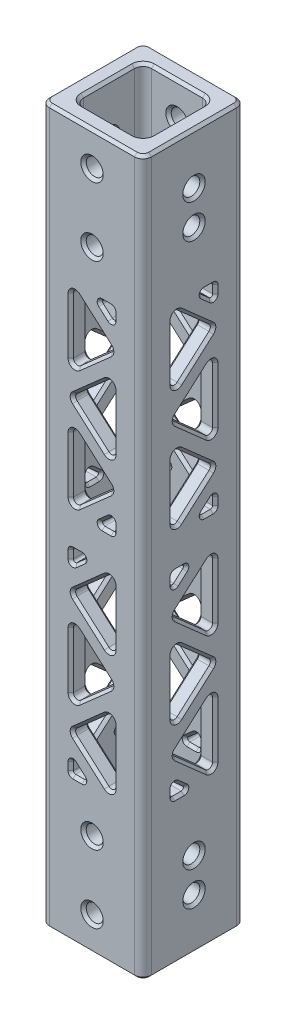
from build123d import *

# Parameters (mm, degrees)
SKETCH1_W                    = 19.05
SKETCH1_H                    = 19.05
SKETCH1_W_2                  = 12.7
SKETCH1_H_2                  = 12.7
BOSS_EXTRUDE1_DEPTH          = 66.675
F_1_8_0_125_DIAMETER_HOLE1_D = 3.175
F_1_8_0_125_DIAMETER_HOLE2_D = 3.175
F_1_8_0_125_DIAMETER_HOLE3_D = 3.175
CUT_EXTRUDE1_REACH           = 70.022
CIRPATTERN2_COUNT            = 4
FILLET1_R                    = 1.5875
FILLET2_R                    = 0.79375
FILLET3_R                    = 0.396875
CHAMFER2_SIZE                = 0.508


with BuildPart() as part:
    # Sketch1 → Boss-Extrude1 (new, symmetric)
    with BuildSketch(Plane(origin=(0, 0, 0), x_dir=(1, 0, 0), z_dir=(0, 1, 0))):
        Rectangle(SKETCH1_W, SKETCH1_H)
        Rectangle(SKETCH1_W_2, SKETCH1_H_2, mode=Mode.SUBTRACT)
    extrude(amount=BOSS_EXTRUDE1_DEPTH, both=True)

    # 1/8 (0.125) Diameter Hole1 (through all)
    with Locations(Plane.ZY.offset(9.525)):
        with Locations((0, 57.15), (0, 50.8)):
            Hole(F_1_8_0_125_DIAMETER_HOLE1_D / 2)

    # 1/8 (0.125) Diameter Hole2 (through all)
    with Locations(Plane(origin=(9.525, 0, 0), x_dir=(0, 0, -1), z_dir=(1, 0, 0))):
        with Locations((0, -50.8), (0, -57.15)):
            Hole(F_1_8_0_125_DIAMETER_HOLE2_D / 2)

    # 1/8 (0.125) Diameter Hole3 (through all)
    with Locations(Plane.XY.offset(9.525)):
        with Locations((0, 60.325), (0, 47.625), (0, -47.625), (0, -60.325)):
            Hole(F_1_8_0_125_DIAMETER_HOLE3_D / 2)

    # Sketch15 → Cut-Extrude1 (cut, up to next)
    with BuildSketch(Plane.XY, mode=Mode.PRIVATE) as cut_extrude1_sk1:
        Polygon((-3.96875, 39.6875), (-0.827576232, 39.6875), (-3.96875, 36.91331643), align=None)
    cut_extrude1_tool1 = extrude(cut_extrude1_sk1.sketch, amount=-CUT_EXTRUDE1_REACH, mode=Mode.PRIVATE) & part.part
    # Sketch15 → Cut-Extrude1 (cut, up to next)
    with BuildSketch(Plane.XY, mode=Mode.PRIVATE) as cut_extrude1_sk2:
        Polygon((-3.96875, 32.677355477), (3.96875, 39.6875), (3.96875, 25.667210953), align=None)
    cut_extrude1_tool2 = extrude(cut_extrude1_sk2.sketch, amount=-CUT_EXTRUDE1_REACH, mode=Mode.PRIVATE) & part.part
    # Sketch15 → Cut-Extrude1 (cut, up to next)
    with BuildSketch(Plane.XY, mode=Mode.PRIVATE) as cut_extrude1_sk3:
        Polygon((-3.96875, 28.441394523), (3.96875, 21.43125), (-3.96875, 14.421105477), align=None)
    cut_extrude1_tool3 = extrude(cut_extrude1_sk3.sketch, amount=-CUT_EXTRUDE1_REACH, mode=Mode.PRIVATE) & part.part
    # Sketch15 → Cut-Extrude1 (cut, up to next)
    with BuildSketch(Plane.XY, mode=Mode.PRIVATE) as cut_extrude1_sk4:
        Polygon((-3.96875, 10.185144523), (3.96875, 17.195289047), (3.96875, 3.175), align=None)
    cut_extrude1_tool4 = extrude(cut_extrude1_sk4.sketch, amount=-CUT_EXTRUDE1_REACH, mode=Mode.PRIVATE) & part.part
    # Sketch15 → Cut-Extrude1 (cut, up to next)
    with BuildSketch(Plane.XY, mode=Mode.PRIVATE) as cut_extrude1_sk5:
        Polygon((-3.96875, 3.175), (-0.827576232, 3.175), (-3.96875, 5.94918357), align=None)
    cut_extrude1_tool5 = extrude(cut_extrude1_sk5.sketch, amount=-CUT_EXTRUDE1_REACH, mode=Mode.PRIVATE) & part.part
    # Sketch15 → Cut-Extrude1 (cut, up to next)
    with BuildSketch(Plane.XY, mode=Mode.PRIVATE) as cut_extrude1_sk6:
        Polygon((0.827576232, -3.175), (3.96875, -3.175), (3.96875, -5.94918357), align=None)
    cut_extrude1_tool6 = extrude(cut_extrude1_sk6.sketch, amount=-CUT_EXTRUDE1_REACH, mode=Mode.PRIVATE) & part.part
    # Sketch15 → Cut-Extrude1 (cut, up to next)
    with BuildSketch(Plane.XY, mode=Mode.PRIVATE) as cut_extrude1_sk7:
        Polygon((-3.96875, -3.175), (3.96875, -10.185144523), (-3.96875, -17.195289047), align=None)
    cut_extrude1_tool7 = extrude(cut_extrude1_sk7.sketch, amount=-CUT_EXTRUDE1_REACH, mode=Mode.PRIVATE) & part.part
    # Sketch15 → Cut-Extrude1 (cut, up to next)
    with BuildSketch(Plane.XY, mode=Mode.PRIVATE) as cut_extrude1_sk8:
        Polygon((-3.96875, -21.43125), (3.96875, -14.421105477), (3.96875, -28.441394523), align=None)
    cut_extrude1_tool8 = extrude(cut_extrude1_sk8.sketch, amount=-CUT_EXTRUDE1_REACH, mode=Mode.PRIVATE) & part.part
    # Sketch15 → Cut-Extrude1 (cut, up to next)
    with BuildSketch(Plane.XY, mode=Mode.PRIVATE) as cut_extrude1_sk9:
        Polygon((-3.96875, -39.6875), (3.96875, -32.677355477), (-3.96875, -25.667210953), align=None)
    cut_extrude1_tool9 = extrude(cut_extrude1_sk9.sketch, amount=-CUT_EXTRUDE1_REACH, mode=Mode.PRIVATE) & part.part
    # Sketch15 → Cut-Extrude1 (cut, up to next)
    with BuildSketch(Plane.XY, mode=Mode.PRIVATE) as cut_extrude1_sk10:
        Polygon((0.827576232, -39.6875), (3.96875, -39.6875), (3.96875, -36.91331643), align=None)
    cut_extrude1_tool10 = extrude(cut_extrude1_sk10.sketch, amount=-CUT_EXTRUDE1_REACH, mode=Mode.PRIVATE) & part.part
    cut_extrude1_1 = cut_extrude1_tool1.solids().sort_by_distance((-2.921692, 38.762772, 0))[0]
    add(cut_extrude1_1, mode=Mode.SUBTRACT)
    cut_extrude1_2 = cut_extrude1_tool2.solids().sort_by_distance((1.322917, 32.677355, 0))[0]
    add(cut_extrude1_2, mode=Mode.SUBTRACT)
    cut_extrude1_3 = cut_extrude1_tool3.solids().sort_by_distance((-1.322917, 21.43125, 0))[0]
    add(cut_extrude1_3, mode=Mode.SUBTRACT)
    cut_extrude1_4 = cut_extrude1_tool4.solids().sort_by_distance((1.322917, 10.185145, 0))[0]
    add(cut_extrude1_4, mode=Mode.SUBTRACT)
    cut_extrude1_5 = cut_extrude1_tool5.solids().sort_by_distance((-2.921692, 4.099728, 0))[0]
    add(cut_extrude1_5, mode=Mode.SUBTRACT)
    cut_extrude1_6 = cut_extrude1_tool6.solids().sort_by_distance((2.921692, -4.099728, 0))[0]
    add(cut_extrude1_6, mode=Mode.SUBTRACT)
    cut_extrude1_7 = cut_extrude1_tool7.solids().sort_by_distance((-1.322917, -10.185145, 0))[0]
    add(cut_extrude1_7, mode=Mode.SUBTRACT)
    cut_extrude1_8 = cut_extrude1_tool8.solids().sort_by_distance((1.322917, -21.43125, 0))[0]
    add(cut_extrude1_8, mode=Mode.SUBTRACT)
    cut_extrude1_9 = cut_extrude1_tool9.solids().sort_by_distance((-1.322917, -32.677355, 0))[0]
    add(cut_extrude1_9, mode=Mode.SUBTRACT)
    cut_extrude1_10 = cut_extrude1_tool10.solids().sort_by_distance((2.921692, -38.762772, 0))[0]
    add(cut_extrude1_10, mode=Mode.SUBTRACT)
    cut_extrude1 = cut_extrude1_1 + cut_extrude1_2 + cut_extrude1_3 + cut_extrude1_4 + cut_extrude1_5 + cut_extrude1_6 + cut_extrude1_7 + cut_extrude1_8 + cut_extrude1_9 + cut_extrude1_10  # Cut-Extrude1 as one shape, for the pattern or mirror that repeats it

    # CirPattern2: Cut-Extrude1 ×4 about axis
    cirpattern2_axis = Axis((0, 0, 0), (0, 1, 0))
    for i in range(1, CIRPATTERN2_COUNT):
        add(cut_extrude1.rotate(cirpattern2_axis, i * 360 / CIRPATTERN2_COUNT), mode=Mode.SUBTRACT)

    # Fillet1
    fillet1_edges = [part.edges().sort_by_distance(p)[0] for p in [
        (6.35, 0, 6.35),
        (6.35, 0, -6.35),
        (-6.35, 0, -6.35),
        (-6.35, 0, 6.35),
        (9.525, 0, 9.525),
        (-9.525, 0, 9.525),
        (-9.525, 0, -9.525),
        (9.525, 0, -9.525),
    ]]
    fillet(fillet1_edges, radius=FILLET1_R)

    # Fillet2
    fillet2_edges = [part.edges().sort_by_distance(p)[0] for p in [
        (-3.96875, 14.421105477, -7.9375),
        (-3.96875, 28.441394523, -7.9375),
        (3.96875, 21.43125, -7.9375),
        (3.96875, 3.175, -7.9375),
        (-3.96875, 10.185144523, -7.9375),
        (3.96875, 17.195289047, -7.9375),
        (-3.96875, -17.195289047, -7.9375),
        (-3.96875, -3.175, -7.9375),
        (3.96875, -10.185144523, -7.9375),
        (3.96875, 39.6875, -7.9375),
        (3.96875, 25.667210953, -7.9375),
        (-3.96875, 32.677355477, -7.9375),
        (-3.96875, -39.6875, -7.9375),
        (-3.96875, -25.667210953, -7.9375),
        (3.96875, -32.677355477, -7.9375),
        (3.96875, -28.441394523, -7.9375),
        (-3.96875, -21.43125, -7.9375),
        (3.96875, -14.421105477, -7.9375),
        (-3.96875, 39.6875, 7.9375),
        (-3.96875, 25.667210953, 7.9375),
        (3.96875, 32.677355477, 7.9375),
        (-7.9375, -28.441394523, -3.96875),
        (-7.9375, -21.43125, 3.96875),
        (-7.9375, -14.421105477, -3.96875),
        (3.96875, 14.421105477, 7.9375),
        (3.96875, 28.441394523, 7.9375),
        (-3.96875, 21.43125, 7.9375),
        (3.96875, -39.6875, 7.9375),
        (3.96875, -25.667210953, 7.9375),
        (-3.96875, -32.677355477, 7.9375),
        (-7.9375, -39.6875, 3.96875),
        (-7.9375, -25.667210953, 3.96875),
        (-7.9375, -32.677355477, -3.96875),
        (-7.9375, 39.6875, -3.96875),
        (-7.9375, 25.667210953, -3.96875),
        (-7.9375, 32.677355477, 3.96875),
        (-7.9375, -17.195289047, 3.96875),
        (-7.9375, -3.175, 3.96875),
        (-7.9375, -10.185144523, -3.96875),
        (-7.9375, 3.175, -3.96875),
        (-7.9375, 10.185144523, 3.96875),
        (-7.9375, 17.195289047, -3.96875),
        (-7.9375, 14.421105477, 3.96875),
        (-7.9375, 28.441394523, 3.96875),
        (-7.9375, 21.43125, -3.96875),
        (7.9375, -17.195289047, -3.96875),
        (7.9375, -3.175, -3.96875),
        (7.9375, -10.185144523, 3.96875),
        (7.9375, 3.175, 3.96875),
        (7.9375, 10.185144523, -3.96875),
        (7.9375, 17.195289047, 3.96875),
        (7.9375, 14.421105477, -3.96875),
        (7.9375, 28.441394523, -3.96875),
        (7.9375, 21.43125, 3.96875),
        (7.9375, -28.441394523, 3.96875),
        (7.9375, -21.43125, -3.96875),
        (7.9375, -14.421105477, 3.96875),
        (-3.96875, -28.441394523, 7.9375),
        (3.96875, -21.43125, 7.9375),
        (-3.96875, -14.421105477, 7.9375),
        (3.96875, -17.195289047, 7.9375),
        (3.96875, -3.175, 7.9375),
        (-3.96875, -10.185144523, 7.9375),
        (-3.96875, 3.175, 7.9375),
        (3.96875, 10.185144523, 7.9375),
        (-3.96875, 17.195289047, 7.9375),
        (7.9375, -39.6875, -3.96875),
        (7.9375, -25.667210953, -3.96875),
        (7.9375, -32.677355477, 3.96875),
        (7.9375, 39.6875, 3.96875),
        (7.9375, 25.667210953, 3.96875),
        (7.9375, 32.677355477, -3.96875),
    ]]
    fillet(fillet2_edges, radius=FILLET2_R)

    # Fillet3
    fillet3_edges = [part.edges().sort_by_distance(p)[0] for p in [
        (3.96875, -5.94918357, -7.9375),
        (0.827576232, -3.175, -7.9375),
        (3.96875, -3.175, -7.9375),
        (3.96875, -36.91331643, -7.9375),
        (3.96875, -39.6875, -7.9375),
        (0.827576232, -39.6875, -7.9375),
        (-3.96875, 3.175, -7.9375),
        (-3.96875, 5.94918357, -7.9375),
        (-0.827576232, 3.175, -7.9375),
        (-3.96875, 36.91331643, -7.9375),
        (-3.96875, 39.6875, -7.9375),
        (-0.827576232, 39.6875, -7.9375),
        (-3.96875, -36.91331643, 7.9375),
        (-3.96875, -39.6875, 7.9375),
        (-0.827576232, -39.6875, 7.9375),
        (3.96875, 36.91331643, 7.9375),
        (3.96875, 39.6875, 7.9375),
        (0.827576232, 39.6875, 7.9375),
        (-3.96875, -5.94918357, 7.9375),
        (-0.827576232, -3.175, 7.9375),
        (-3.96875, -3.175, 7.9375),
        (3.96875, 3.175, 7.9375),
        (3.96875, 5.94918357, 7.9375),
        (0.827576232, 3.175, 7.9375),
        (-7.9375, 3.175, 3.96875),
        (-7.9375, 5.94918357, 3.96875),
        (-7.9375, 3.175, 0.827576232),
        (-7.9375, -36.91331643, -3.96875),
        (-7.9375, -39.6875, -3.96875),
        (-7.9375, -39.6875, -0.827576232),
        (-7.9375, -5.94918357, -3.96875),
        (-7.9375, -3.175, -0.827576232),
        (-7.9375, -3.175, -3.96875),
        (7.9375, -5.94918357, 3.96875),
        (7.9375, -3.175, 0.827576232),
        (7.9375, -3.175, 3.96875),
        (7.9375, 36.91331643, -3.96875),
        (7.9375, 39.6875, -3.96875),
        (7.9375, 39.6875, -0.827576232),
        (7.9375, 3.175, -3.96875),
        (7.9375, 5.94918357, -3.96875),
        (7.9375, 3.175, -0.827576232),
        (7.9375, -36.91331643, 3.96875),
        (7.9375, -39.6875, 3.96875),
        (7.9375, -39.6875, 0.827576232),
        (-7.9375, 36.91331643, 3.96875),
        (-7.9375, 39.6875, 3.96875),
        (-7.9375, 39.6875, 0.827576232),
    ]]
    fillet(fillet3_edges, radius=FILLET3_R)

    # Chamfer2
    chamfer2_edges = [part.edges().sort_by_distance(p)[0] for p in [
        (9.525, 3.175, -2.724184334),
        (6.35, 3.175, -2.724184334),
        (9.525, 4.320528112, -3.96875),
        (6.35, 4.320528112, -3.96875),
        (9.525, 4.617999722, -2.461466982),
        (6.35, 4.617999722, -2.461466982),
        (3.96875, -4.320528112, -9.525),
        (3.96875, -4.320528112, -6.35),
        (2.461466982, -4.617999722, -9.525),
        (2.461466982, -4.617999722, -6.35),
        (2.724184334, -3.175, -9.525),
        (2.724184334, -3.175, -6.35),
        (-2.724184334, 3.175, -9.525),
        (-2.724184334, 3.175, -6.35),
        (-3.96875, 4.320528112, -9.525),
        (-3.96875, 4.320528112, -6.35),
        (-2.461466982, 4.617999722, -9.525),
        (-2.461466982, 4.617999722, -6.35),
        (-9.525, 4.617999722, 2.461466982),
        (-6.35, 4.617999722, 2.461466982),
        (-9.525, 3.175, 2.724184334),
        (-6.35, 3.175, 2.724184334),
        (-9.525, 4.320528112, 3.96875),
        (-6.35, 4.320528112, 3.96875),
        (-9.525, -4.320528112, -3.96875),
        (-6.35, -4.320528112, -3.96875),
        (-9.525, -4.617999722, -2.461466982),
        (-6.35, -4.617999722, -2.461466982),
        (-9.525, -3.175, -2.724184334),
        (-6.35, -3.175, -2.724184334),
        (-2.724184334, -3.175, 9.525),
        (-2.724184334, -3.175, 6.35),
        (-3.96875, -4.320528112, 9.525),
        (-3.96875, -4.320528112, 6.35),
        (-2.461466982, -4.617999722, 9.525),
        (-2.461466982, -4.617999722, 6.35),
        (2.461466982, 4.617999722, 9.525),
        (2.461466982, 4.617999722, 6.35),
        (2.724184334, 3.175, 9.525),
        (2.724184334, 3.175, 6.35),
        (3.96875, 4.320528112, 9.525),
        (3.96875, 4.320528112, 6.35),
        (2.724184334, -39.6875, -9.525),
        (2.724184334, -39.6875, -6.35),
        (2.461466982, -38.244500278, -9.525),
        (2.461466982, -38.244500278, -6.35),
        (3.96875, -38.541971888, -9.525),
        (3.96875, -38.541971888, -6.35),
        (-2.461466982, 38.244500278, -9.525),
        (-2.461466982, 38.244500278, -6.35),
        (-3.96875, 38.541971888, -9.525),
        (-3.96875, 38.541971888, -6.35),
        (-2.724184334, 39.6875, -9.525),
        (-2.724184334, 39.6875, -6.35),
        (9.525, -39.6875, 2.724184334),
        (6.35, -39.6875, 2.724184334),
        (9.525, -38.244500278, 2.461466982),
        (6.35, -38.244500278, 2.461466982),
        (9.525, -38.541971888, 3.96875),
        (6.35, -38.541971888, 3.96875),
        (9.525, 38.244500278, -2.461466982),
        (6.35, 38.244500278, -2.461466982),
        (9.525, 38.541971888, -3.96875),
        (6.35, 38.541971888, -3.96875),
        (9.525, 39.6875, -2.724184334),
        (6.35, 39.6875, -2.724184334),
        (-2.724184334, -39.6875, 9.525),
        (-2.724184334, -39.6875, 6.35),
        (-2.461466982, -38.244500278, 9.525),
        (-2.461466982, -38.244500278, 6.35),
        (-3.96875, -38.541971888, 9.525),
        (-3.96875, -38.541971888, 6.35),
        (2.461466982, 38.244500278, 9.525),
        (2.461466982, 38.244500278, 6.35),
        (3.96875, 38.541971888, 9.525),
        (3.96875, 38.541971888, 6.35),
        (2.724184334, 39.6875, 9.525),
        (2.724184334, 39.6875, 6.35),
        (-9.525, -39.6875, -2.724184334),
        (-6.35, -39.6875, -2.724184334),
        (-9.525, -38.244500278, -2.461466982),
        (-6.35, -38.244500278, -2.461466982),
        (-9.525, -38.541971888, -3.96875),
        (-6.35, -38.541971888, -3.96875),
        (-9.525, 38.244500278, 2.461466982),
        (-6.35, 38.244500278, 2.461466982),
        (-9.525, 38.541971888, 3.96875),
        (-6.35, 38.541971888, 3.96875),
        (-9.525, 39.6875, 2.724184334),
        (-6.35, 39.6875, 2.724184334),
        (6.35, -3.291241996, 3.852508004),
        (9.525, -3.291241996, 3.852508004),
        (6.35, -3.431427999, 1.50530045),
        (9.525, -3.431427999, 1.50530045),
        (6.35, -5.430965494, 3.735037215),
        (9.525, -5.430965494, 3.735037215),
        (6.35, 3.291241996, -3.852508004),
        (9.525, 3.291241996, -3.852508004),
        (6.35, 5.430965494, -3.735037215),
        (9.525, 5.430965494, -3.735037215),
        (6.35, 3.431427999, -1.50530045),
        (9.525, 3.431427999, -1.50530045),
        (3.735037215, -5.430965494, -6.35),
        (3.735037215, -5.430965494, -9.525),
        (1.50530045, -3.431427999, -6.35),
        (1.50530045, -3.431427999, -9.525),
        (3.852508004, -3.291241996, -6.35),
        (3.852508004, -3.291241996, -9.525),
        (-3.852508004, 3.291241996, -6.35),
        (-3.852508004, 3.291241996, -9.525),
        (-3.735037215, 5.430965494, -6.35),
        (-3.735037215, 5.430965494, -9.525),
        (-1.50530045, 3.431427999, -6.35),
        (-1.50530045, 3.431427999, -9.525),
        (-6.35, 3.431427999, 1.50530045),
        (-9.525, 3.431427999, 1.50530045),
        (-6.35, 5.430965494, 3.735037215),
        (-9.525, 5.430965494, 3.735037215),
        (-6.35, 3.291241996, 3.852508004),
        (-9.525, 3.291241996, 3.852508004),
        (-6.35, -5.430965494, -3.735037215),
        (-9.525, -5.430965494, -3.735037215),
        (-6.35, -3.431427999, -1.50530045),
        (-9.525, -3.431427999, -1.50530045),
        (-6.35, -3.291241996, -3.852508004),
        (-9.525, -3.291241996, -3.852508004),
        (-3.852508004, -3.291241996, 6.35),
        (-3.852508004, -3.291241996, 9.525),
        (-1.50530045, -3.431427999, 6.35),
        (-1.50530045, -3.431427999, 9.525),
        (-3.735037215, -5.430965494, 6.35),
        (-3.735037215, -5.430965494, 9.525),
        (1.50530045, 3.431427999, 6.35),
        (1.50530045, 3.431427999, 9.525),
        (3.735037215, 5.430965494, 6.35),
        (3.735037215, 5.430965494, 9.525),
        (3.852508004, 3.291241996, 6.35),
        (3.852508004, 3.291241996, 9.525),
        (1.50530045, -39.431072001, -6.35),
        (1.50530045, -39.431072001, -9.525),
        (3.735037215, -37.431534506, -6.35),
        (3.735037215, -37.431534506, -9.525),
        (3.852508004, -39.571258004, -6.35),
        (3.852508004, -39.571258004, -9.525),
        (-3.735037215, 37.431534506, -6.35),
        (-3.735037215, 37.431534506, -9.525),
        (-1.50530045, 39.431072001, -6.35),
        (-1.50530045, 39.431072001, -9.525),
        (-3.852508004, 39.571258004, -6.35),
        (-3.852508004, 39.571258004, -9.525),
        (6.35, -39.431072001, 1.50530045),
        (9.525, -39.431072001, 1.50530045),
        (6.35, -39.571258004, 3.852508004),
        (9.525, -39.571258004, 3.852508004),
        (6.35, -37.431534506, 3.735037215),
        (9.525, -37.431534506, 3.735037215),
        (6.35, 37.431534506, -3.735037215),
        (9.525, 37.431534506, -3.735037215),
        (6.35, 39.431072001, -1.50530045),
        (9.525, 39.431072001, -1.50530045),
        (6.35, 39.571258004, -3.852508004),
        (9.525, 39.571258004, -3.852508004),
        (-1.50530045, -39.431072001, 6.35),
        (-1.50530045, -39.431072001, 9.525),
        (-3.735037215, -37.431534506, 6.35),
        (-3.735037215, -37.431534506, 9.525),
        (-3.852508004, -39.571258004, 6.35),
        (-3.852508004, -39.571258004, 9.525),
        (3.735037215, 37.431534506, 6.35),
        (3.735037215, 37.431534506, 9.525),
        (1.50530045, 39.431072001, 6.35),
        (1.50530045, 39.431072001, 9.525),
        (3.852508004, 39.571258004, 6.35),
        (3.852508004, 39.571258004, 9.525),
        (-6.35, -39.431072001, -1.50530045),
        (-9.525, -39.431072001, -1.50530045),
        (-6.35, -39.571258004, -3.852508004),
        (-9.525, -39.571258004, -3.852508004),
        (-6.35, -37.431534506, -3.735037215),
        (-9.525, -37.431534506, -3.735037215),
        (-6.35, 37.431534506, 3.735037215),
        (-9.525, 37.431534506, 3.735037215),
        (-6.35, 39.571258004, 3.852508004),
        (-9.525, 39.571258004, 3.852508004),
        (-6.35, 39.431072001, 1.50530045),
        (-9.525, 39.431072001, 1.50530045),
        (-6.35, 50.8, 1.5875),
        (6.35, 50.8, 1.5875),
        (9.525, 50.8, 1.5875),
        (-9.525, 50.8, 1.5875),
        (6.35, 57.15, 1.5875),
        (-6.35, 57.15, 1.5875),
        (-9.525, 57.15, 1.5875),
        (9.525, 57.15, 1.5875),
        (0, -66.675, -9.525),
        (0, 66.675, -9.525),
        (9.525, -66.675, 0),
        (0, -66.675, 9.525),
        (-9.525, -66.675, 0),
        (0, -66.675, 6.35),
        (6.35, -66.675, 0),
        (6.35, -57.15, -1.5875),
        (0, -66.675, -6.35),
        (-6.35, -57.15, -1.5875),
        (-6.35, -66.675, 0),
        (-9.060032015, -66.675, 9.060032015),
        (-9.525, -57.15, -1.5875),
        (-9.060032015, -66.675, -9.060032015),
        (9.060032015, -66.675, 9.060032015),
        (9.525, -57.15, -1.5875),
        (9.060032015, -66.675, -9.060032015),
        (9.525, 66.675, 0),
        (-9.525, 66.675, 0),
        (0, 66.675, 9.525),
        (6.35, 66.675, 0),
        (0, 66.675, 6.35),
        (-6.35, 66.675, 0),
        (0, 66.675, -6.35),
        (-9.060032015, 66.675, 9.060032015),
        (-9.060032015, 66.675, -9.060032015),
        (9.060032015, 66.675, 9.060032015),
        (9.060032015, 66.675, -9.060032015),
        (5.885032015, -66.675, -5.885032015),
        (5.885032015, 66.675, -5.885032015),
        (5.885032015, -66.675, 5.885032015),
        (5.885032015, 66.675, 5.885032015),
        (-5.885032015, -66.675, 5.885032015),
        (-5.885032015, 66.675, 5.885032015),
        (-5.885032015, -66.675, -5.885032015),
        (-5.885032015, 66.675, -5.885032015),
        (-0.322768924, -35.897368613, 9.525),
        (-0.322768924, -35.897368613, 6.35),
        (3.96875, -32.677355477, 9.525),
        (3.96875, -32.677355477, 6.35),
        (-0.322768924, -29.45734234, 9.525),
        (-0.322768924, -29.45734234, 6.35),
        (-3.96875, -21.43125, 9.525),
        (-3.96875, -21.43125, 6.35),
        (0.322768924, -24.651263136, 9.525),
        (0.322768924, -24.651263136, 6.35),
        (0.322768924, -18.211236864, 9.525),
        (0.322768924, -18.211236864, 6.35),
        (-0.322768924, -13.40515766, 9.525),
        (-0.322768924, -13.40515766, 6.35),
        (3.96875, -10.185144523, 9.525),
        (3.96875, -10.185144523, 6.35),
        (-0.322768924, -6.965131387, 9.525),
        (-0.322768924, -6.965131387, 6.35),
        (-3.96875, 10.185144523, 9.525),
        (-3.96875, 10.185144523, 6.35),
        (0.322768924, 6.965131387, 9.525),
        (0.322768924, 6.965131387, 6.35),
        (0.322768924, 13.40515766, 9.525),
        (0.322768924, 13.40515766, 6.35),
        (-0.322768924, 18.211236864, 9.525),
        (-0.322768924, 18.211236864, 6.35),
        (-6.35, -50.8, -1.5875),
        (6.35, -50.8, -1.5875),
        (3.96875, 21.43125, 9.525),
        (9.525, -50.8, -1.5875),
        (3.96875, 21.43125, 6.35),
        (-9.525, -50.8, -1.5875),
        (-0.322768924, 24.651263136, 9.525),
        (-0.322768924, 24.651263136, 6.35),
        (-3.96875, 32.677355477, 9.525),
        (-3.96875, 32.677355477, 6.35),
        (0.322768924, 29.45734234, 9.525),
        (0.322768924, 29.45734234, 6.35),
        (0.322768924, 35.897368613, 9.525),
        (0.322768924, 35.897368613, 6.35),
        (9.525, -29.45734234, 0.322768924),
        (6.35, -29.45734234, 0.322768924),
        (9.525, -35.897368613, 0.322768924),
        (6.35, -35.897368613, 0.322768924),
        (9.525, -32.677355477, -3.96875),
        (6.35, -32.677355477, -3.96875),
        (9.525, -21.43125, 3.96875),
        (6.35, -21.43125, 3.96875),
        (9.525, -24.651263136, -0.322768924),
        (6.35, -24.651263136, -0.322768924),
        (9.525, -18.211236864, -0.322768924),
        (6.35, -18.211236864, -0.322768924),
        (9.525, -13.40515766, 0.322768924),
        (6.35, -13.40515766, 0.322768924),
        (9.525, -10.185144523, -3.96875),
        (6.35, -10.185144523, -3.96875),
        (9.525, -6.965131387, 0.322768924),
        (6.35, -6.965131387, 0.322768924),
        (9.525, 10.185144523, 3.96875),
        (6.35, 10.185144523, 3.96875),
        (9.525, 6.965131387, -0.322768924),
        (6.35, 6.965131387, -0.322768924),
        (9.525, 13.40515766, -0.322768924),
        (6.35, 13.40515766, -0.322768924),
        (9.525, 18.211236864, 0.322768924),
        (6.35, 18.211236864, 0.322768924),
        (9.525, 21.43125, -3.96875),
        (6.35, 21.43125, -3.96875),
        (9.525, 24.651263136, 0.322768924),
        (6.35, 24.651263136, 0.322768924),
        (9.525, 32.677355477, 3.96875),
        (6.35, 32.677355477, 3.96875),
        (9.525, 29.45734234, -0.322768924),
        (6.35, 29.45734234, -0.322768924),
        (9.525, 35.897368613, -0.322768924),
        (6.35, 35.897368613, -0.322768924),
        (0.322768924, -35.897368613, -9.525),
        (0.322768924, -35.897368613, -6.35),
        (-3.96875, -32.677355477, -9.525),
        (-3.96875, -32.677355477, -6.35),
        (0.322768924, -29.45734234, -9.525),
        (0.322768924, -29.45734234, -6.35),
        (3.96875, -21.43125, -9.525),
        (3.96875, -21.43125, -6.35),
        (-0.322768924, -24.651263136, -9.525),
        (-0.322768924, -24.651263136, -6.35),
        (-0.322768924, -18.211236864, -9.525),
        (-0.322768924, -18.211236864, -6.35),
        (0.322768924, -13.40515766, -9.525),
        (0.322768924, -13.40515766, -6.35),
        (-3.96875, -10.185144523, -9.525),
        (-3.96875, -10.185144523, -6.35),
        (0.322768924, -6.965131387, -9.525),
        (0.322768924, -6.965131387, -6.35),
        (3.96875, 10.185144523, -9.525),
        (3.96875, 10.185144523, -6.35),
        (-0.322768924, 6.965131387, -9.525),
        (-0.322768924, 6.965131387, -6.35),
        (-0.322768924, 13.40515766, -9.525),
        (-0.322768924, 13.40515766, -6.35),
        (0.322768924, 18.211236864, -9.525),
        (0.322768924, 18.211236864, -6.35),
        (-3.96875, 21.43125, -9.525),
        (-3.96875, 21.43125, -6.35),
        (0.322768924, 24.651263136, -9.525),
        (0.322768924, 24.651263136, -6.35),
        (3.96875, 32.677355477, -9.525),
        (3.96875, 32.677355477, -6.35),
        (-0.322768924, 29.45734234, -9.525),
        (-0.322768924, 29.45734234, -6.35),
        (-0.322768924, 35.897368613, -9.525),
        (-0.322768924, 35.897368613, -6.35),
        (-9.525, -35.897368613, -0.322768924),
        (-6.35, -35.897368613, -0.322768924),
        (-9.525, -32.677355477, 3.96875),
        (-6.35, -32.677355477, 3.96875),
        (-9.525, -29.45734234, -0.322768924),
        (-6.35, -29.45734234, -0.322768924),
        (-9.525, -21.43125, -3.96875),
        (-6.35, -21.43125, -3.96875),
        (-9.525, -24.651263136, 0.322768924),
        (-6.35, -24.651263136, 0.322768924),
        (-9.525, -18.211236864, 0.322768924),
        (-6.35, -18.211236864, 0.322768924),
        (-9.525, -13.40515766, -0.322768924),
        (-6.35, -13.40515766, -0.322768924),
        (-9.525, -10.185144523, 3.96875),
        (-6.35, -10.185144523, 3.96875),
        (-9.525, -6.965131387, -0.322768924),
        (-6.35, -6.965131387, -0.322768924),
        (-9.525, 10.185144523, -3.96875),
        (-6.35, 10.185144523, -3.96875),
        (-9.525, 6.965131387, 0.322768924),
        (-6.35, 6.965131387, 0.322768924),
        (-9.525, 13.40515766, 0.322768924),
        (-6.35, 13.40515766, 0.322768924),
        (-9.525, 18.211236864, -0.322768924),
        (-6.35, 18.211236864, -0.322768924),
        (-9.525, 21.43125, 3.96875),
        (-6.35, 21.43125, 3.96875),
        (-9.525, 24.651263136, -0.322768924),
        (1.5875, -60.325, 6.35),
        (-6.35, 24.651263136, -0.322768924),
        (1.5875, -60.325, -6.35),
        (-9.525, 29.45734234, 0.322768924),
        (1.5875, -60.325, -9.525),
        (-6.35, 29.45734234, 0.322768924),
        (1.5875, -60.325, 9.525),
        (-9.525, 35.897368613, 0.322768924),
        (-6.35, 35.897368613, 0.322768924),
        (-9.525, 32.677355477, -3.96875),
        (-6.35, 32.677355477, -3.96875),
        (3.50132443, -38.651063847, 6.35),
        (3.50132443, -38.651063847, 9.525),
        (3.50132443, -26.703647106, 6.35),
        (3.50132443, -26.703647106, 9.525),
        (-3.563418442, -32.677355477, 6.35),
        (-3.563418442, -32.677355477, 9.525),
        (-3.50132443, -27.404958371, 6.35),
        (-3.50132443, -27.404958371, 9.525),
        (3.563418442, -21.43125, 6.35),
        (3.563418442, -21.43125, 9.525),
        (-3.50132443, -15.457541629, 6.35),
        (-3.50132443, -15.457541629, 9.525),
        (3.50132443, -16.158852894, 6.35),
        (3.50132443, -16.158852894, 9.525),
        (3.50132443, -4.211436153, 6.35),
        (3.50132443, -4.211436153, 9.525),
        (-3.563418442, -10.185144523, 6.35),
        (-3.563418442, -10.185144523, 9.525),
        (-3.50132443, 4.211436153, 6.35),
        (-3.50132443, 4.211436153, 9.525),
        (3.563418442, 10.185144523, 6.35),
        (3.563418442, 10.185144523, 9.525),
        (-3.50132443, 16.158852894, 6.35),
        (-3.50132443, 16.158852894, 9.525),
        (3.50132443, 15.457541629, 6.35),
        (3.50132443, 15.457541629, 9.525),
        (3.50132443, 27.404958371, 6.35),
        (3.50132443, 27.404958371, 9.525),
        (-3.563418442, 21.43125, 6.35),
        (-3.563418442, 21.43125, 9.525),
        (-3.50132443, 26.703647106, 6.35),
        (-3.50132443, 26.703647106, 9.525),
        (3.563418442, 32.677355477, 6.35),
        (3.563418442, 32.677355477, 9.525),
        (-3.50132443, 38.651063847, 6.35),
        (-3.50132443, 38.651063847, 9.525),
        (6.35, -32.677355477, 3.563418442),
        (9.525, -32.677355477, 3.563418442),
        (6.35, -38.651063847, -3.50132443),
        (9.525, -38.651063847, -3.50132443),
        (6.35, -26.703647106, -3.50132443),
        (9.525, -26.703647106, -3.50132443),
        (6.35, -27.404958371, 3.50132443),
        (9.525, -27.404958371, 3.50132443),
        (6.35, -15.457541629, 3.50132443),
        (9.525, -15.457541629, 3.50132443),
        (6.35, -21.43125, -3.563418442),
        (9.525, -21.43125, -3.563418442),
        (6.35, -16.158852894, -3.50132443),
        (9.525, -16.158852894, -3.50132443),
        (6.35, -4.211436153, -3.50132443),
        (9.525, -4.211436153, -3.50132443),
        (6.35, -10.185144523, 3.563418442),
        (9.525, -10.185144523, 3.563418442),
        (6.35, 4.211436153, 3.50132443),
        (9.525, 4.211436153, 3.50132443),
        (6.35, 16.158852894, 3.50132443),
        (9.525, 16.158852894, 3.50132443),
        (6.35, 10.185144523, -3.563418442),
        (9.525, 10.185144523, -3.563418442),
        (6.35, 15.457541629, -3.50132443),
        (9.525, 15.457541629, -3.50132443),
        (6.35, 27.404958371, -3.50132443),
        (9.525, 27.404958371, -3.50132443),
        (6.35, 21.43125, 3.563418442),
        (9.525, 21.43125, 3.563418442),
        (6.35, 26.703647106, 3.50132443),
        (9.525, 26.703647106, 3.50132443),
        (6.35, 32.677355477, -3.563418442),
        (9.525, 32.677355477, -3.563418442),
        (6.35, 38.651063847, 3.50132443),
        (9.525, 38.651063847, 3.50132443),
        (-3.50132443, -38.651063847, -6.35),
        (-3.50132443, -38.651063847, -9.525),
        (3.563418442, -32.677355477, -6.35),
        (3.563418442, -32.677355477, -9.525),
        (-3.50132443, -26.703647106, -6.35),
        (-3.50132443, -26.703647106, -9.525),
        (3.50132443, -27.404958371, -6.35),
        (3.50132443, -27.404958371, -9.525),
        (3.50132443, -15.457541629, -6.35),
        (3.50132443, -15.457541629, -9.525),
        (-3.563418442, -21.43125, -6.35),
        (-3.563418442, -21.43125, -9.525),
        (-3.50132443, -16.158852894, -6.35),
        (-3.50132443, -16.158852894, -9.525),
        (-3.50132443, -4.211436153, -6.35),
        (-3.50132443, -4.211436153, -9.525),
        (3.563418442, -10.185144523, -6.35),
        (3.563418442, -10.185144523, -9.525),
        (3.50132443, 4.211436153, -6.35),
        (3.50132443, 4.211436153, -9.525),
        (-3.563418442, 10.185144523, -6.35),
        (-3.563418442, 10.185144523, -9.525),
        (3.50132443, 16.158852894, -6.35),
        (3.50132443, 16.158852894, -9.525),
        (-3.50132443, 15.457541629, -6.35),
        (-3.50132443, 15.457541629, -9.525),
        (-3.50132443, 27.404958371, -6.35),
        (-3.50132443, 27.404958371, -9.525),
        (3.563418442, 21.43125, -6.35),
        (3.563418442, 21.43125, -9.525),
        (3.50132443, 26.703647106, -6.35),
        (3.50132443, 26.703647106, -9.525),
        (-3.563418442, 32.677355477, -6.35),
        (-3.563418442, 32.677355477, -9.525),
        (3.50132443, 38.651063847, -6.35),
        (3.50132443, 38.651063847, -9.525),
        (-6.35, -38.651063847, 3.50132443),
        (-9.525, -38.651063847, 3.50132443),
        (-6.35, -26.703647106, 3.50132443),
        (-9.525, -26.703647106, 3.50132443),
        (-6.35, -32.677355477, -3.563418442),
        (-9.525, -32.677355477, -3.563418442),
        (-6.35, -27.404958371, -3.50132443),
        (-9.525, -27.404958371, -3.50132443),
        (-6.35, -15.457541629, -3.50132443),
        (-9.525, -15.457541629, -3.50132443),
        (-6.35, -21.43125, 3.563418442),
        (-9.525, -21.43125, 3.563418442),
        (-6.35, -16.158852894, 3.50132443),
        (-9.525, -16.158852894, 3.50132443),
        (-6.35, -10.185144523, -3.563418442),
        (-9.525, -10.185144523, -3.563418442),
        (-6.35, -4.211436153, 3.50132443),
        (-9.525, -4.211436153, 3.50132443),
        (-6.35, 4.211436153, -3.50132443),
        (-9.525, 4.211436153, -3.50132443),
        (-6.35, 16.158852894, -3.50132443),
        (-9.525, 16.158852894, -3.50132443),
        (-6.35, 10.185144523, 3.563418442),
        (-9.525, 10.185144523, 3.563418442),
        (-6.35, 15.457541629, 3.50132443),
        (-9.525, 15.457541629, 3.50132443),
        (-6.35, 21.43125, -3.563418442),
        (-9.525, 21.43125, -3.563418442),
        (-6.35, 27.404958371, 3.50132443),
        (-9.525, 27.404958371, 3.50132443),
        (-6.35, 32.677355477, 3.563418442),
        (-9.525, 32.677355477, 3.563418442),
        (-6.35, 26.703647106, -3.50132443),
        (-9.525, 26.703647106, -3.50132443),
        (-6.35, 38.651063847, -3.50132443),
        (-9.525, 38.651063847, -3.50132443),
        (1.5875, -47.625, -6.35),
        (1.5875, -47.625, 6.35),
        (1.5875, -47.625, 9.525),
        (1.5875, -47.625, -9.525),
        (1.5875, 47.625, 6.35),
        (1.5875, 47.625, -6.35),
        (1.5875, 47.625, -9.525),
        (1.5875, 47.625, 9.525),
        (1.5875, 60.325, 6.35),
        (1.5875, 60.325, -6.35),
        (1.5875, 60.325, -9.525),
        (1.5875, 60.325, 9.525),
        (9.525, -3.175, 2.724184334),
        (6.35, -3.175, 2.724184334),
        (9.525, -4.320528112, 3.96875),
        (6.35, -4.320528112, 3.96875),
        (9.525, -4.617999722, 2.461466982),
        (6.35, -4.617999722, 2.461466982),
    ]]
    chamfer(chamfer2_edges, length=CHAMFER2_SIZE)


solid = part.part
